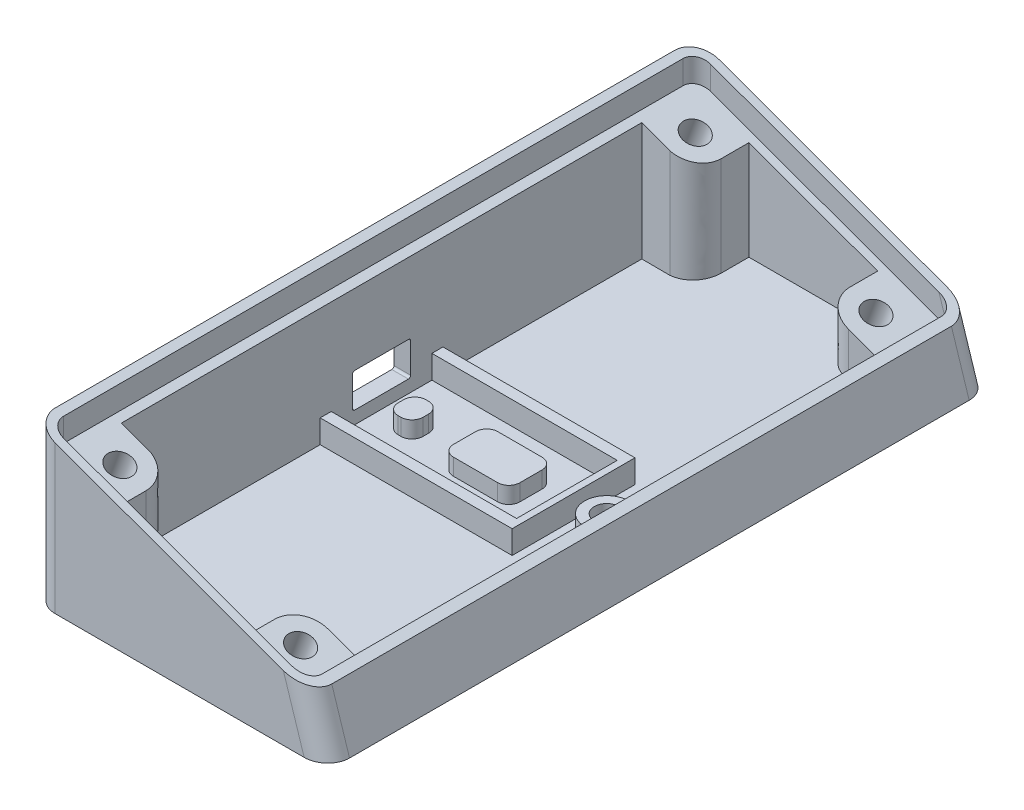
from build123d import *

# Parameters (mm, degrees)
BOSS_EXTRU_1_DEPTH      = 60
CONG_1_R                = 4
COQUE1_T                = -1.5
BOSS_EXTRU_2_REACH      = 86.523
ESQUISSE5_W             = 12
ESQUISSE5_H             = 8
ESQUISSE5_W_2           = 4.5
ESQUISSE5_H_2           = 5
BOSS_EXTRU_3_DEPTH      = 3
ENL_V_MAT_EXTRU_2_REACH = 87.009
ESQUISSE6_W             = 10.5
ESQUISSE6_H             = 6.2
CONG_2_R                = 2
BOSS_EXTRU_4_DEPTH      = 4.2
ESQUISSE8_R             = 4
BOSS_EXTRU_5_DEPTH      = 4
ESQUISSE9_R             = 2.25
ENL_V_MAT_EXTRU_3_DEPTH = 84.345824934
BOSS_EXTRU_6_START      = 1
BOSS_EXTRU_6_DEPTH      = 18.429688487
BOSS_EXTRU_6_2_DEPTH    = 4.829414633
BOSS_EXTRU_6_START_2    = 47.018315389
BOSS_EXTRU_6_3_DEPTH    = 9.981684611
BOSS_EXTRU_6_START_3    = -57
BOSS_EXTRU_6_4_DEPTH    = 9.981684511
BOSS_EXTRU_6_START_4    = -47.020439353
BOSS_EXTRU_6_5_DEPTH    = 0.020439353
BOSS_EXTRU_6_START_5    = 47
BOSS_EXTRU_6_6_DEPTH    = 0.02055902
BOSS_EXTRU_6_START_6    = 5.829414633
BOSS_EXTRU_6_7_DEPTH    = 18.170585367
ESQUISSE11_R            = 2.25
ENL_V_MAT_EXTRU_4_DEPTH = 6.6
CONG_3_R                = 0.4
ESQUISSE14_R            = 2
ENL_V_MAT_EXTRU_6_DEPTH = 2
ESQUISSE15_R            = 5.1
ENL_V_MAT_EXTRU_7_DEPTH = 0.4


with BuildPart() as part:
    # Esquisse1 → Boss.-Extru.1 (new, symmetric)
    with BuildSketch(Plane.XY):
        Polygon((0, 0), (53.21, 0), (50, 10), (0, 28.198511713), align=None)
    extrude(amount=BOSS_EXTRU_1_DEPTH, both=True)

    # Congé1
    cong_1_edges = [part.edges().sort_by_distance(p)[0] for p in [
        (51.605, 5, 60),
        (0, 14.099255857, 60),
        (51.605, 5, -60),
        (0, 14.099255857, -60),
    ]]
    fillet(cong_1_edges, radius=CONG_1_R)

    # Coque1
    coque1_openings = [part.faces().sort_by_distance(p)[0] for p in [
        (24.994997427, 19.101076644, 0),
    ]]
    offset(amount=COQUE1_T, openings=coque1_openings, kind=Kind.INTERSECTION)

    # Boss.-Extru.2: up to this plane
    boss_extru_2_end = Plane(origin=(-1.368080573, 24.43974123, 60), z_dir=(-0.3420201433256695, -0.9396926207859081, 0))
    # Esquisse4 → Boss.-Extru.2 (add, up to the surface)
    with BuildSketch(Plane(origin=(0, 1.5, 0), x_dir=(1, 0, 0), z_dir=(0, 1, 0)), mode=Mode.PRIVATE) as boss_extru_2_sk1:
        with BuildLine():
            Line((51.153113619, -56), (51.153113619, 56))
            add(Edge.make_bspline(
                [(51.153113619, 56), (51.153113619, 58.5), (48.52746965, 58.5)],
                knots=[0, 0, 0, 1.570796327, 1.570796327, 1.570796327], degree=2, weights=[1, 0.707106781, 1]))
            Line((48.52746965, 58.5), (4, 58.5))
            ThreePointArc((4, 58.5), (2.232233047, 57.767766953), (1.5, 56))
            Line((1.5, 56), (1.5, -56))
            ThreePointArc((1.5, -56), (2.232233047, -57.767766953), (4, -58.5))
            Line((4, -58.5), (48.52746965, -58.5))
            add(Edge.make_bspline(
                [(48.52746965, -58.5), (51.153113619, -58.5), (51.153113619, -56)],
                knots=[1.570796327, 1.570796327, 1.570796327, 3.141592654, 3.141592654, 3.141592654], degree=2, weights=[1, 0.707106781, 1]))
        make_face()
        with BuildLine():
            Line((3, 56), (3, -56))
            ThreePointArc((3, -56), (3.292893219, -56.707106781), (4, -57))
            Line((4, -57), (48.52746965, -57))
            add(Edge.make_bspline(
                [(48.52746965, -57), (48.667862887, -57), (48.804503112, -56.977268476), (49.069620052, -56.884680006), (49.190562346, -56.817547726), (49.406120034, -56.637082098), (49.494089239, -56.528808181), (49.61932931, -56.278058054), (49.653113619, -56.140975451), (49.653113619, -56)],
                knots=[0, 0, 0, 0, 0.25, 0.25, 0.5, 0.5, 0.75, 0.75, 1, 1, 1, 1], degree=3))
            Line((49.653113619, -56), (49.653113619, 56))
            add(Edge.make_bspline(
                [(49.653113619, 56), (49.653113619, 56.140560164), (49.618987902, 56.278470031), (49.495168818, 56.526916657), (49.405339988, 56.637625841), (49.192348678, 56.816161002), (49.068961612, 56.884888289), (48.805496783, 56.97694309), (48.667615973, 57), (48.52746965, 57)],
                knots=[0, 0, 0, 0, 0.25, 0.25, 0.5, 0.5, 0.75, 0.75, 1, 1, 1, 1], degree=3))
            Line((48.52746965, 57), (4, 57))
            ThreePointArc((4, 57), (3.292893219, 56.707106781), (3, 56))
        make_face(mode=Mode.SUBTRACT)
    boss_extru_2_tool1 = split(extrude(boss_extru_2_sk1.sketch, amount=BOSS_EXTRU_2_REACH, mode=Mode.PRIVATE), bisect_by=boss_extru_2_end, keep=Keep.BOTH, mode=Mode.PRIVATE)
    add(boss_extru_2_tool1.solids().sort_by_distance((49.882113, 1.5, 0))[0])

    # Esquisse5 → Boss.-Extru.3 (add)
    with BuildSketch(Plane(origin=(0, 1.5, 0), x_dir=(1, 0, 0), z_dir=(0, 1, 0))):
        with Locations((24, 0)):
            Rectangle(ESQUISSE5_W, ESQUISSE5_H)
        with Locations((8.75, 0)):
            Rectangle(ESQUISSE5_W_2, ESQUISSE5_H_2)
    extrude(amount=BOSS_EXTRU_3_DEPTH)

    # Esquisse6 → Enlèv. mat.-Extru.2 (cut, up to next)
    with BuildSketch(Plane(origin=(0, 0, 0), x_dir=(0, 0, -1), z_dir=(1, 0, 0)), mode=Mode.PRIVATE) as enl_v_mat_extru_2_sk1:
        with Locations((0, 6.9)):
            Rectangle(ESQUISSE6_W, ESQUISSE6_H)
    enl_v_mat_extru_2_tool1 = extrude(enl_v_mat_extru_2_sk1.sketch, amount=ENL_V_MAT_EXTRU_2_REACH, mode=Mode.PRIVATE) & part.part
    add(enl_v_mat_extru_2_tool1.solids().sort_by_distance((0, 6.9, 0))[0], mode=Mode.SUBTRACT)

    # Congé2
    cong_2_edges = [part.edges().sort_by_distance(p)[0] for p in [
        (30, 3, 4),
        (30, 3, -4),
        (18, 3, -4),
        (18, 3, 4),
        (11, 3, 2.5),
        (11, 3, -2.5),
        (6.5, 3, -2.5),
        (6.5, 3, 2.5),
    ]]
    fillet(cong_2_edges, radius=CONG_2_R)

    # Esquisse7 → Boss.-Extru.4 (add)
    with BuildSketch(Plane(origin=(0, 1.5, 0), x_dir=(1, 0, 0), z_dir=(0, 1, 0))):
        Polygon((3, 9.1), (36.5, 9.1), (36.5, -9.1), (3, -9.1), (3, -11.1), (37.7, -11.1), (37.7, 11.1), (3, 11.1), align=None)
    extrude(amount=BOSS_EXTRU_4_DEPTH)

    # Esquisse8 → Boss.-Extru.5 (add)
    with BuildSketch(Plane(origin=(0, 1.5, 0), x_dir=(1, 0, 0), z_dir=(0, 1, 0))):
        with Locations(Location((43.7, 0, 0), (0, 0, 270))):
            Circle(ESQUISSE8_R)
    extrude(amount=BOSS_EXTRU_5_DEPTH)

    # Esquisse9 → Enlèv. mat.-Extru.3 (cut, through all)
    with BuildSketch(Plane(origin=(0, 5.5, 0), x_dir=(1, 0, 0), z_dir=(0, 1, 0))):
        with Locations(Location((43.7, 0, 0), (0, 0, 270))):
            Circle(ESQUISSE9_R)
    extrude(amount=-ENL_V_MAT_EXTRU_3_DEPTH, mode=Mode.SUBTRACT)

    # Boss.-Extru.6: read off the stored shape, not the designer's step
    # Boss.-Extru.6 outline → Boss.-Extru.6 (add)
    with BuildSketch(Plane(origin=(0, 0, 0), x_dir=(1, 0, 0), z_dir=(0, 1, 0)).offset(BOSS_EXTRU_6_START)):
        with BuildLine():
            Line((12.396926208, -57), (12.396926208, -52))
            add(Edge.make_bspline(
                [(12.396926208, -52), (12.396926208, -47.41076307), (8.100251137, -47.018315489)],
                knots=[3.141592654, 3.141592654, 3.141592654, 4.626769632, 4.626769632, 4.626769632], degree=2, weights=[1, 0.7367207, 1]))
            Line((8.100251137, -47.018315489), (3, -47.040152465))
            Line((3, -47.040152465), (3, -56))
            ThreePointArc((3, -56), (3.292893219, -56.707106781), (4, -57))
            Line((4, -57), (12.396926208, -57))
        make_face()
        with BuildLine():
            Line((3, 56), (3, 47.040152465))
            Line((3, 47.040152465), (8.100251137, 47.018315489))
            add(Edge.make_bspline(
                [(8.100251137, 47.018315489), (12.396926208, 47.41076307), (12.396926208, 52)],
                knots=[4.798008329, 4.798008329, 4.798008329, 6.283185307, 6.283185307, 6.283185307], degree=2, weights=[1, 0.7367207, 1]))
            Line((12.396926208, 52), (12.396926208, 57))
            Line((12.396926208, 57), (4, 57))
            ThreePointArc((4, 57), (3.292893219, 56.707106781), (3, 56))
        make_face()
    extrude(amount=BOSS_EXTRU_6_DEPTH)

    # Boss.-Extru.6 2 outline → Boss.-Extru.6 2 (add)
    with BuildSketch(Plane(origin=(0, 0, 0), x_dir=(1, 0, 0), z_dir=(0, 1, 0)).offset(BOSS_EXTRU_6_START)):
        with BuildLine():
            Line((35.66798221, -52), (35.66798221, -57))
            Line((35.66798221, -57), (48.52746965, -57))
            add(Edge.make_bspline(
                [(48.52746965, -57), (48.667862887, -57), (48.804503112, -56.977268476), (49.069620052, -56.884680006), (49.190562346, -56.817547726), (49.406120034, -56.637082098), (49.494089239, -56.528808181), (49.61932931, -56.278058054), (49.653113619, -56.140975451), (49.653113619, -56)],
                knots=[0, 0, 0, 0, 0.25, 0.25, 0.5, 0.5, 0.75, 0.75, 1, 1, 1, 1], degree=3))
            Line((49.653113619, -56), (49.653113619, -47))
            Line((49.653113619, -47), (40.366445314, -47))
            add(Edge.make_bspline(
                [(40.366445314, -47), (35.66798221, -47), (35.66798221, -52)],
                knots=[1.570796327, 1.570796327, 1.570796327, 3.141592654, 3.141592654, 3.141592654], degree=2, weights=[1, 0.707106781, 1]))
        make_face()
        with BuildLine():
            Line((40.366445314, 47), (49.653113619, 47))
            Line((49.653113619, 47), (49.653113619, 56))
            add(Edge.make_bspline(
                [(49.653113619, 56), (49.653113619, 56.140560164), (49.618987902, 56.278470031), (49.495168818, 56.526916657), (49.405339988, 56.637625841), (49.192348678, 56.816161002), (49.068961612, 56.884888289), (48.805496783, 56.97694309), (48.667615973, 57), (48.52746965, 57)],
                knots=[0, 0, 0, 0, 0.25, 0.25, 0.5, 0.5, 0.75, 0.75, 1, 1, 1, 1], degree=3))
            Line((48.52746965, 57), (35.66798221, 57))
            Line((35.66798221, 57), (35.66798221, 52))
            add(Edge.make_bspline(
                [(35.66798221, 52), (35.66798221, 47), (40.366445314, 47)],
                knots=[0, 0, 0, 1.570796327, 1.570796327, 1.570796327], degree=2, weights=[1, 0.707106781, 1]))
        make_face()
    extrude(amount=BOSS_EXTRU_6_2_DEPTH)

    # Boss.-Extru.6 3 outline → Boss.-Extru.6 3 (add)
    with BuildSketch(Plane.XY.offset(BOSS_EXTRU_6_START_2)):
        Polygon((49.653113619, 5.869545228), (35.66798221, 10.959716783), (35.66798221, 5.829414633), (49.653113619, 5.829414633), align=None)
        Polygon((12.396926208, 19.429688487), (3, 22.849889921), (3, 19.429688487), align=None)
    extrude(amount=BOSS_EXTRU_6_3_DEPTH)

    # Boss.-Extru.6 4 outline → Boss.-Extru.6 4 (add)
    with BuildSketch(Plane.XY.offset(BOSS_EXTRU_6_START_3)):
        Polygon((49.653113619, 5.869545228), (35.66798221, 10.959716783), (35.66798221, 5.829414633), (49.653113619, 5.829414633), align=None)
        Polygon((12.396926208, 19.429688487), (3, 22.849889921), (3, 19.429688487), align=None)
    extrude(amount=BOSS_EXTRU_6_4_DEPTH)

    # Boss.-Extru.6 5 outline → Boss.-Extru.6 5 (add)
    with BuildSketch(Plane.XY.offset(BOSS_EXTRU_6_START_4)):
        Polygon((49.653113619, 5.869545228), (35.66798221, 10.959716783), (35.66798221, 5.829414633), (49.653113619, 5.829414633), align=None)
    extrude(amount=BOSS_EXTRU_6_5_DEPTH)

    # Boss.-Extru.6 6 outline → Boss.-Extru.6 6 (add)
    with BuildSketch(Plane.XY.offset(BOSS_EXTRU_6_START_5)):
        Polygon((49.653113619, 5.869545228), (35.66798221, 10.959716783), (35.66798221, 5.829414633), (49.653113619, 5.829414633), align=None)
    extrude(amount=BOSS_EXTRU_6_6_DEPTH)

    # Boss.-Extru.6 7 outline → Boss.-Extru.6 7 (cut)
    with BuildSketch(Plane(origin=(0, 0, 0), x_dir=(1, 0, 0), z_dir=(0, 1, 0)).offset(BOSS_EXTRU_6_START_6)):
        with BuildLine():
            add(Edge.make_bspline(
                [(8.100251137, 47.018315489), (12.396926208, 47.41076307), (12.396926208, 52)],
                knots=[4.798008329, 4.798008329, 4.798008329, 6.283185307, 6.283185307, 6.283185307], degree=2, weights=[1, 0.7367207, 1]))
            Line((8.100251137, 47.018315489), (12.396926208, 47.018315489))
            Line((12.396926208, 47.018315489), (12.396926208, 52))
        make_face()
        Polygon((3, 47.018315489), (8.100251137, 47.018315489), (3, 47.040152465), align=None)
        with BuildLine():
            Line((12.396926208, -47.018315389), (8.100251137, -47.018315489))
            add(Edge.make_bspline(
                [(12.396926208, -52), (12.396926208, -47.41076307), (8.100251137, -47.018315489)],
                knots=[3.141592654, 3.141592654, 3.141592654, 4.626769632, 4.626769632, 4.626769632], degree=2, weights=[1, 0.7367207, 1]))
            Line((12.396926208, -52), (12.396926208, -47.018315389))
        make_face()
        Polygon((3, -47.040152465), (8.100251137, -47.018315489), (3, -47.018315389), align=None)
        with BuildLine():
            Line((35.66798221, 52), (35.66798221, 47))
            Line((35.66798221, 47), (40.366445314, 47))
            add(Edge.make_bspline(
                [(40.366445314, 47), (40.287343772, 47), (40.207552732, 47.001771488), (40.127130137, 47.005376232), (40.046141109, 47.01087296), (39.960137963, 47.018728272), (39.95561712, 47.019147041), (39.951094768, 47.019571805), (39.946570918, 47.020002573), (38.657392353, 47.144432692), (37.175025071, 47.77425323), (36.091784284, 49.090919412), (35.66798221, 50.674633293), (35.66798221, 52)],
                knots=[1.477297963, 1.477297963, 1.477297963, 1.477297963, 1.477297963, 1.477297963, 1.570796327, 1.570796327, 1.570796327, 1.570796327, 1.575982007, 1.575982007, 1.575982007, 1.575982007, 3.04809429, 3.04809429, 3.04809429, 3.04809429, 3.04809429, 3.04809429], degree=5, weights=[1, 1, 1.000000146, 1.000000124, 1, 1, 1, 1, 1, 1, 0.971799078, 0.973721729, 1, 1]))
        make_face()
        with BuildLine():
            Line((40.366445314, -47), (35.66798221, -47))
            Line((35.66798221, -47), (35.66798221, -52))
            add(Edge.make_bspline(
                [(35.66798221, -52), (35.66798221, -50.674888732), (36.091611637, -49.09157995), (37.17437226, -47.775010339), (38.656309752, -47.144902002), (39.945581064, -47.020096933), (39.950352904, -47.019641537), (39.955123079, -47.019192821), (39.959891575, -47.018750776), (40.046141979, -47.010872901), (40.127130785, -47.005376203), (40.20755316, -47.001771478), (40.287343985, -47), (40.366445314, -47)],
                knots=[1.669764093, 1.669764093, 1.669764093, 1.669764093, 1.669764093, 1.669764093, 3.141592654, 3.141592654, 3.141592654, 3.141592654, 3.147062307, 3.147062307, 3.147062307, 3.147062307, 3.24056042, 3.24056042, 3.24056042, 3.24056042, 3.24056042, 3.24056042], degree=5, weights=[1, 1, 0.973743112, 0.971816525, 1, 1, 1, 1, 1, 1, 1.000000124, 1.000000146, 1, 1]))
        make_face()
    extrude(amount=BOSS_EXTRU_6_7_DEPTH, mode=Mode.SUBTRACT)

    # Esquisse11 → Enlèv. mat.-Extru.4 (cut)
    with BuildSketch(Plane(origin=(7.694746397, 21.141141975, 0), x_dir=(0.9396926207859082, -0.34202014332566943, 0), z_dir=(0.34202014332566943, 0.9396926207859082, 0))):
        with Locations(Location((0.003955237, -52, 0), (0, 0, 180))):
            Circle(ESQUISSE11_R)
        with Locations(Location((0.003955237, 52, 0), (0, 0, 180))):
            Circle(ESQUISSE11_R)
        with Locations(Location((34.768495776, 52, 0), (0, 0, 180))):
            Circle(ESQUISSE11_R)
        with Locations(Location((34.768495776, -52, 0), (0, 0, 180))):
            Circle(ESQUISSE11_R)
    extrude(amount=-ENL_V_MAT_EXTRU_4_DEPTH, mode=Mode.SUBTRACT)

    # Congé3
    cong_3_edges = [part.edges().sort_by_distance(p)[0] for p in [
        (1.5, 3.8, -5.25),
        (1.5, 10, 5.25),
        (1.5, 3.8, 5.25),
        (1.5, 10, -5.25),
    ]]
    fillet(cong_3_edges, radius=CONG_3_R)

    # Esquisse14 → Enlèv. mat.-Extru.6 (cut)
    with BuildSketch(Plane(origin=(5.437413451, 14.939170677, 0), x_dir=(0.9396926207859082, -0.34202014332566943, 0), z_dir=(0.34202014332566943, 0.9396926207859082, 0))):
        with Locations(Location((0.003955237, -52, 0), (0, 0, 180))):
            Circle(ESQUISSE14_R)
        with Locations(Location((34.768495776, -52, 0), (0, 0, 180))):
            Circle(ESQUISSE14_R)
        with Locations(Location((0.003955237, 52, 0), (0, 0, 180))):
            Circle(ESQUISSE14_R)
        with Locations(Location((34.768495776, 52, 0), (0, 0, 180))):
            Circle(ESQUISSE14_R)
    extrude(amount=-ENL_V_MAT_EXTRU_6_DEPTH, mode=Mode.SUBTRACT)

    # Esquisse15 → Enlèv. mat.-Extru.7 (cut)
    with BuildSketch(Plane.XZ):
        with Locations(Location((7.698463104, 52, 0), (0, 0, 270))):
            Circle(ESQUISSE15_R)
        with Locations(Location((40.366445314, 52, 0), (0, 0, 270))):
            Circle(ESQUISSE15_R)
        with Locations(Location((7.698463104, -52, 0), (0, 0, 270))):
            Circle(ESQUISSE15_R)
        with Locations(Location((40.366445314, -52, 0), (0, 0, 270))):
            Circle(ESQUISSE15_R)
    extrude(amount=-ENL_V_MAT_EXTRU_7_DEPTH, mode=Mode.SUBTRACT)


solid = part.part
